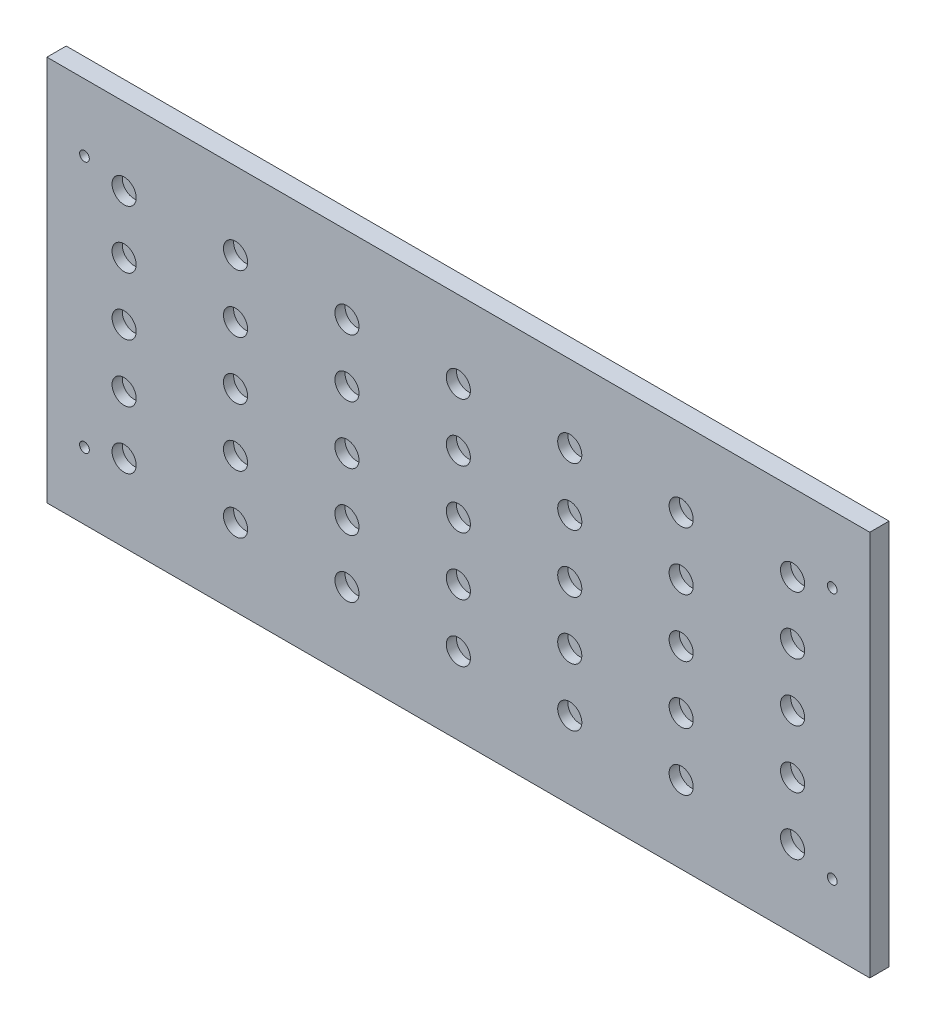
from build123d import *

# Parameters (mm, degrees)
SKETCH1_W                 = 270.7
SKETCH1_H                 = 127
SKETCH1_R                 = 1.6
WALL_DEPTH                = 6.35
SKETCH5_R                 = 3.96875
RODSUPPORTCUTOUT_DEPTH    = 3.35
SUPPORTPATTERN_COUNT      = 7
SUPPORTPATTERN_PITCH      = 36.65
SUPPORTPATTERN_COUNT_DIR2 = 5
SUPPORTPATTERN_PITCH_DIR2 = 19.05


with BuildPart() as part:
    # Sketch1 → Wall (new body)
    with BuildSketch(Plane.XY):
        with Locations((135.35, 63.5)):
            Rectangle(SKETCH1_W, SKETCH1_H)
        with Locations((12.35, 105)):
            Circle(SKETCH1_R, mode=Mode.SUBTRACT)
        with Locations((258.35, 105)):
            Circle(SKETCH1_R, mode=Mode.SUBTRACT)
        with Locations((258.35, 22)):
            Circle(SKETCH1_R, mode=Mode.SUBTRACT)
        with Locations((12.35, 22)):
            Circle(SKETCH1_R, mode=Mode.SUBTRACT)
    extrude(amount=WALL_DEPTH)

    # Sketch5 → RodSupportCutout (cut)
    with BuildSketch(Plane.XY.offset(6.35)):
        with Locations((25.4, 101.6)):
            Circle(SKETCH5_R)
    rodsupportcutout = extrude(amount=-RODSUPPORTCUTOUT_DEPTH, mode=Mode.SUBTRACT)

    # SupportPattern: RodSupportCutout 7 × 5
    with Locations(*[(i * SUPPORTPATTERN_PITCH, -j * SUPPORTPATTERN_PITCH_DIR2, 0) for i in range(SUPPORTPATTERN_COUNT) for j in range(SUPPORTPATTERN_COUNT_DIR2) if (i, j) != (0, 0)]):
        add(rodsupportcutout, mode=Mode.SUBTRACT)


solid = part.part
